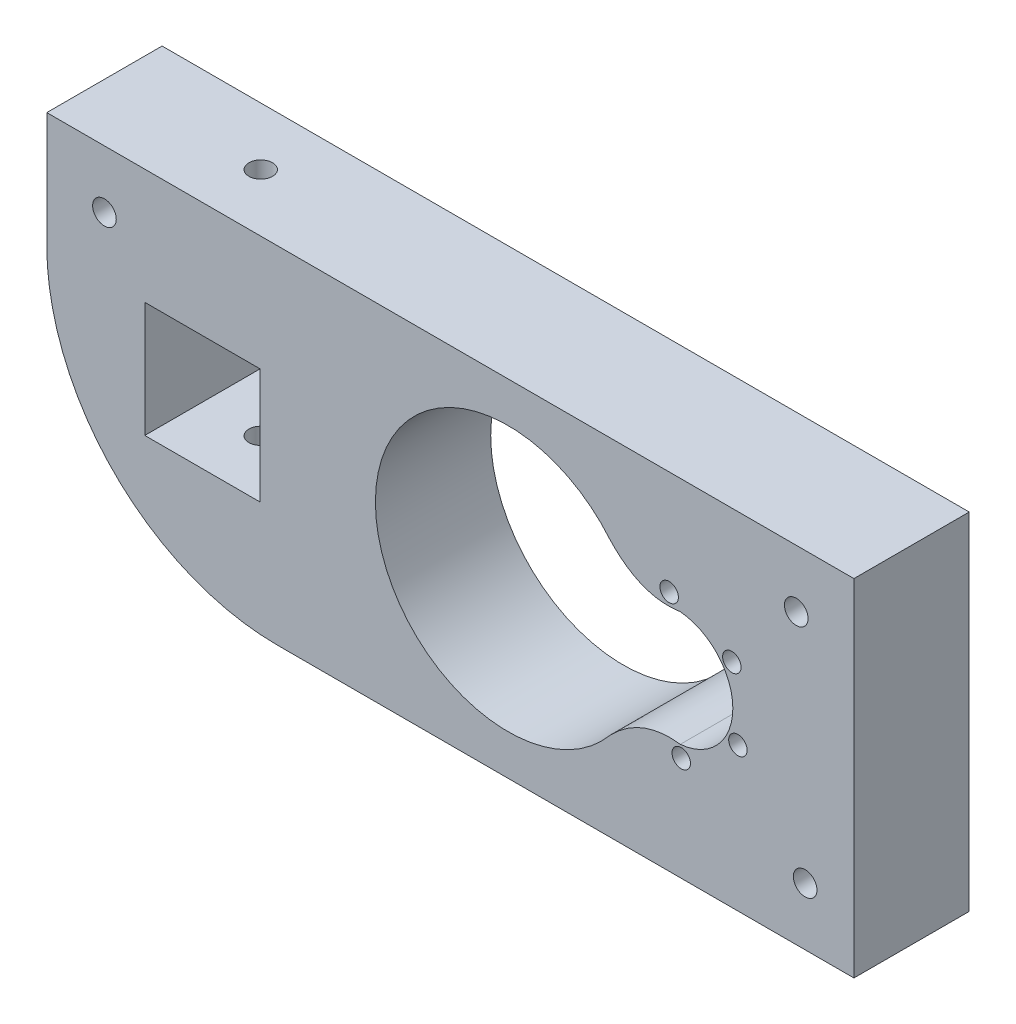
from build123d import *

# Parameters (mm, degrees)
ESQUISSE1_W             = 70
ESQUISSE1_H             = 30
BOSS_EXTRU_1_DEPTH      = 10
ESQUISSE2_R             = 0.8
ENL_V_MAT_EXTRU_1_DEPTH = 77.811457479
ESQUISSE3_R             = 1.025
ENL_V_MAT_EXTRU_2_DEPTH = 77.811457622
CONG_2_R                = 20
ESQUISSE4_OUTSIDE_W     = 87.362
ESQUISSE4_OUTSIDE_H     = 47.362
ESQUISSE4_OUTSIDE_W_2   = 10
ESQUISSE4_OUTSIDE_H_2   = 10
ENL_V_MAT_EXTRU_3_DEPTH = 77.811457622
ESQUISSE6_R             = 1.025
ENL_V_MAT_EXTRU_4_DEPTH = 77.811457622


with BuildPart() as part:
    # Esquisse1 → Boss.-Extru.1 (new body)
    with BuildSketch(Plane.XY):
        with Locations((35, 15)):
            Rectangle(ESQUISSE1_W, ESQUISSE1_H)
    extrude(amount=BOSS_EXTRU_1_DEPTH)

    # Esquisse2 → Enlèv. mat.-Extru.1 (cut, through all)
    with BuildSketch(Plane.XY.offset(10)):
        with Locations((53.974554028, 20.976947928)):
            Circle(ESQUISSE2_R)
        with Locations((59.413465757, 18.443523524)):
            Circle(ESQUISSE2_R)
        with Locations((59.938911728, 12.466575596)):
            Circle(ESQUISSE2_R)
        with Locations((55.025445972, 9.023052072)):
            Circle(ESQUISSE2_R)
        with BuildLine():
            ThreePointArc((54.940833126, 19.980528702), (59.5, 15), (54.940833126, 10.019471298))
            add(Edge.make_bspline(
                [(48.86, 7.668533571), (51.540343022, 10.446024006), (54.940833126, 10.019471298)],
                knots=[0, 0, 0, 1, 1, 1], degree=2))
            ThreePointArc((48.86, 7.668533571), (28.5, 15), (48.86, 22.331466429))
            add(Edge.make_bspline(
                [(48.86, 22.331466429), (51.534478996, 19.459310032), (54.940833126, 19.980528702)],
                knots=[0, 0, 0, 1, 1, 1], degree=2))
        make_face()
    extrude(amount=-ENL_V_MAT_EXTRU_1_DEPTH, mode=Mode.SUBTRACT)

    # Esquisse3 → Enlèv. mat.-Extru.2 (cut, through all)
    with BuildSketch(Plane.XY.offset(10)):
        with Locations((5, 25)):
            Circle(ESQUISSE3_R)
        with Locations((65.771138483, 5)):
            Circle(ESQUISSE3_R)
        with Locations((65, 25)):
            Circle(ESQUISSE3_R)
    extrude(amount=-ENL_V_MAT_EXTRU_2_DEPTH, mode=Mode.SUBTRACT)

    # Congé2
    cong_2_edges = [part.edges().sort_by_distance(p)[0] for p in [
        (0, 0, 5),
    ]]
    fillet(cong_2_edges, radius=CONG_2_R)

    # Esquisse4 outside → Enlèv. mat.-Extru.3 (cut, through all)
    # profile 1 of 2: a face of its own
    with BuildSketch(Plane.XY.offset(10)):
        with Locations((35, 15)):
            Rectangle(ESQUISSE4_OUTSIDE_W, ESQUISSE4_OUTSIDE_H)
        with BuildLine():
            Line((0, 30), (0, 20))
            ThreePointArc((0, 20), (5.857864376, 5.857864376), (20, 0))
            Line((20, 0), (70, 0))
            Line((70, 0), (70, 30))
            Line((70, 30), (0, 30))
        make_face(mode=Mode.SUBTRACT)
    # profile 2 of 2: a face of its own
    with BuildSketch(Plane.XY.offset(10)):
        with Locations((13.50000003, 15)):
            Rectangle(ESQUISSE4_OUTSIDE_W_2, ESQUISSE4_OUTSIDE_H_2)
    extrude(amount=-ENL_V_MAT_EXTRU_3_DEPTH, mode=Mode.SUBTRACT)

    # Esquisse6 → Enlèv. mat.-Extru.4 (cut, through all)
    with BuildSketch(Plane(origin=(0, 30, 0), x_dir=(1, 0, 0), z_dir=(0, 1, 0))):
        with Locations((13.556741795, -5)):
            Circle(ESQUISSE6_R)
    extrude(amount=-ENL_V_MAT_EXTRU_4_DEPTH, mode=Mode.SUBTRACT)


solid = part.part
